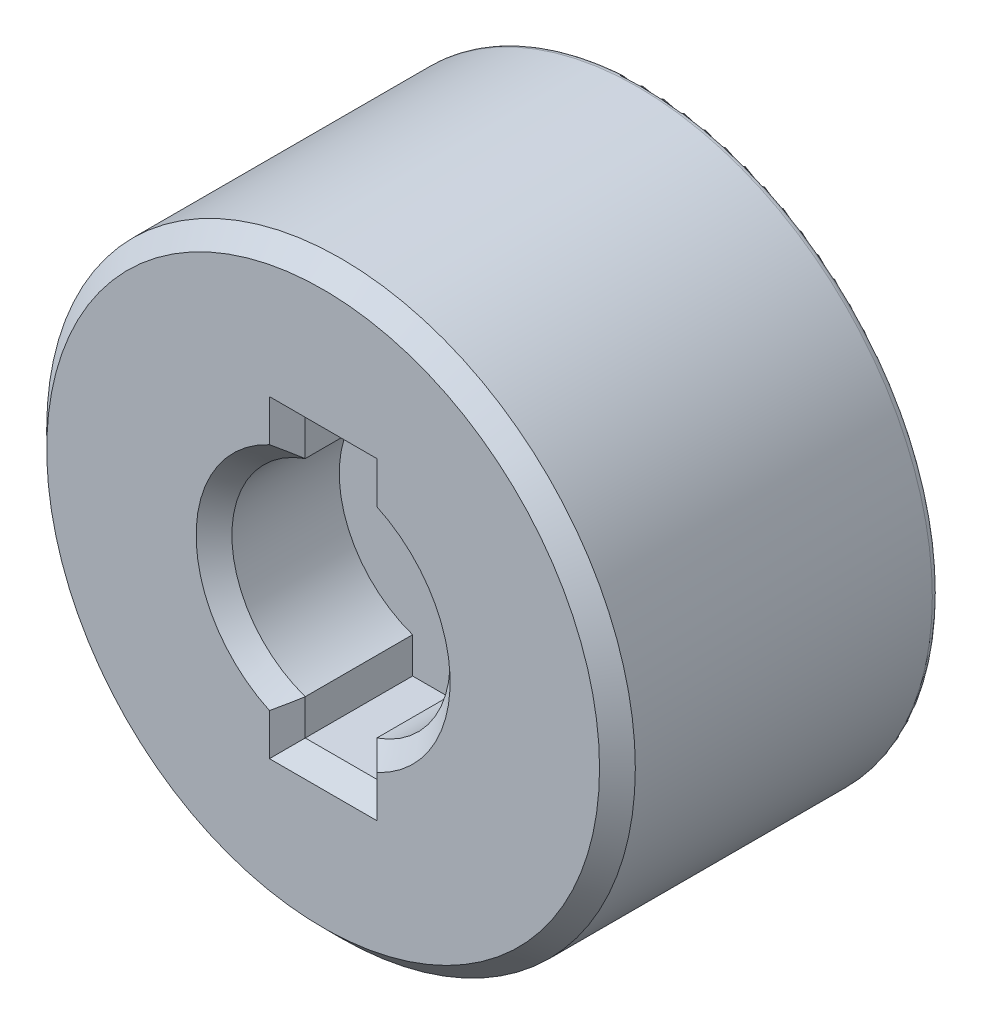
from build123d import *

# Parameters (mm, degrees)
SKETCH1_R           = 6.725
SKETCH1_R_2         = 3.05
BOSS_EXTRUDE1_DEPTH = 4.5
SKETCH3_R           = 3.05
BOSS_EXTRUDE3_DEPTH = 1
BOSS_EXTRUDE4_DEPTH = 3
SKETCH5_R           = 8.225
SKETCH5_R_2         = 6.725
BOSS_EXTRUDE5_DEPTH = 9
FILLET1_R           = 0.2
CUT_EXTRUDE1_REACH  = 14.867
SKETCH6_R           = 1.25
SKETCH7_W           = 2
SKETCH7_H           = 1
CUT_EXTRUDE2_DEPTH  = 3.5
CHAMFER1_SIZE       = 0.5


# Read off the part's stored shape, not the designer's step: Boss-Extrude2
with BuildPart() as part:
    # Sketch1 → Boss-Extrude1 (new body)
    with BuildSketch(Plane.XY):
        Circle(SKETCH1_R)
        Circle(SKETCH1_R_2, mode=Mode.SUBTRACT)
    extrude(amount=BOSS_EXTRUDE1_DEPTH)

    # Boss-Extrude2 outline → Boss-Extrude2 (revolve)
    with BuildSketch(Plane.XZ):
        with BuildLine():
            Line((6.725000003, -3.25921624), (6.725, 1e-09))
            Line((6.725, 1e-09), (3.599999993, 4e-09))
            ThreePointArc((3.599999993, 4e-09), (5.413596666, -1.388851743), (6.725000003, -3.25921624))
        make_face()
    revolve(axis=Axis((0, 0, 0), (0, 0, 1)))

    # Sketch3 → Boss-Extrude3 (add)
    with BuildSketch(Plane(origin=(0, 0, 0), x_dir=(-1, 0, 0), z_dir=(0, 0, -1))):
        Circle(SKETCH3_R)
    extrude(amount=-BOSS_EXTRUDE3_DEPTH)

    # Sketch4 → Boss-Extrude4 (add)
    with BuildSketch(Plane(origin=(0, 0, 0), x_dir=(-1, 0, 0), z_dir=(0, 0, -1))):
        Polygon((0, -2.944486373), (2.55, -1.472243186), (2.55, 1.472243186), (0, 2.944486373), (-2.55, 1.472243186), (-2.55, -1.472243186), align=None)
    extrude(amount=BOSS_EXTRUDE4_DEPTH)

    # Sketch5 → Boss-Extrude5 (add)
    with BuildSketch(Plane.XY.offset(4.5)):
        Circle(SKETCH5_R)
        Circle(SKETCH5_R_2, mode=Mode.SUBTRACT)
    extrude(amount=-BOSS_EXTRUDE5_DEPTH)

    # Fillet1
    fillet1_edges = [part.edges().sort_by_distance(p)[0] for p in [
        (1.275, -2.20836478, 0),
        (2.55, -1.472243186, -1.5),
        (-1.275, -2.20836478, 0),
        (0, -2.944486373, -1.5),
        (-2.55, 0, 0),
        (-2.55, -1.472243186, -1.5),
        (-1.275, 2.20836478, 0),
        (-2.55, 1.472243186, -1.5),
        (1.275, 2.20836478, 0),
        (0, 2.944486373, -1.5),
        (2.55, 0, 0),
        (2.55, 1.472243186, -1.5),
        (1.275, -2.20836478, -3),
        (-1.275, -2.20836478, -3),
        (-2.55, 0, -3),
        (-1.275, 2.20836478, -3),
        (1.275, 2.20836478, -3),
        (2.55, 0, -3),
        (-8.225, 0, -4.5),
        (-6.725, 0, -4.5),
        (-3.599999993, 0, 4e-09),
    ]]
    fillet(fillet1_edges, radius=FILLET1_R)

    # Sketch6 → Cut-Extrude1 (cut, up to next)
    with BuildSketch(Plane.XY.offset(1), mode=Mode.PRIVATE) as cut_extrude1_sk1:
        Circle(SKETCH6_R)
    cut_extrude1_tool1 = extrude(cut_extrude1_sk1.sketch, amount=-CUT_EXTRUDE1_REACH, mode=Mode.PRIVATE) & part.part
    add(cut_extrude1_tool1.solids().sort_by_distance((0, 0, 1))[0], mode=Mode.SUBTRACT)

    # Sketch7 → Cut-Extrude2 (cut)
    with BuildSketch(Plane.XY.offset(4.5)):
        with Locations((0, 3.381405907)):
            Rectangle(SKETCH7_W, SKETCH7_H)
        with Locations((0, -3.381405907)):
            Rectangle(SKETCH7_W, SKETCH7_H)
    extrude(amount=-CUT_EXTRUDE2_DEPTH, mode=Mode.SUBTRACT)

    # Chamfer1
    chamfer1_edges = [part.edges().sort_by_distance(p)[0] for p in [
        (-3.05, 0, 4.5),
        (3.05, 0, 4.5),
        (1, 3.381405907, 4.5),
        (0, 3.881405907, 4.5),
        (-1, 3.381405907, 4.5),
        (1, -3.381405907, 4.5),
        (-1, -3.381405907, 4.5),
        (0, -3.881405907, 4.5),
        (-8.225, 0, 4.5),
    ]]
    chamfer(chamfer1_edges, length=CHAMFER1_SIZE)


solid = part.part
